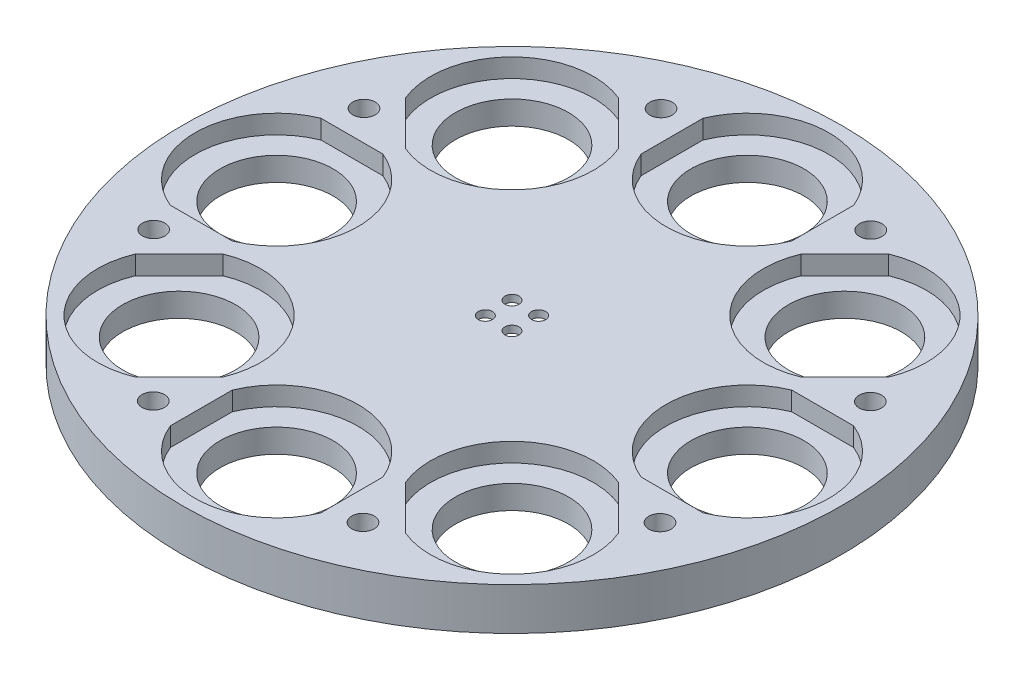
from build123d import *

# Parameters (mm, degrees)
SKETCH1_R           = 70
SKETCH1_R_2         = 12
BOSS_EXTRUDE1_DEPTH = 25
CUT_EXTRUDE1_DEPTH  = 10
SKETCH3_R           = 20
CUT_EXTRUDE2_DEPTH  = 7.5
CUT_EXTRUDE3_START  = -6
SKETCH4_R           = 70
CUT_EXTRUDE3_DEPTH  = 6
SKETCH5_R           = 1.5
CUT_EXTRUDE4_DEPTH  = 100.278648258
SKETCH7_R           = 2.38125
CUT_EXTRUDE5_DEPTH  = 100.403219264


with BuildPart() as part:
    # Sketch1 → Boss-Extrude1 (new body)
    with BuildSketch(Plane(origin=(0, 0, 0), x_dir=(1, 0, 0), z_dir=(0, 1, 0))):
        Circle(SKETCH1_R)
        with Locations((50, 0)):
            Circle(SKETCH1_R_2, mode=Mode.SUBTRACT)
        with Locations((35.355339059, -35.355339059)):
            Circle(SKETCH1_R_2, mode=Mode.SUBTRACT)
        with Locations((0, -50)):
            Circle(SKETCH1_R_2, mode=Mode.SUBTRACT)
        with Locations((-35.355339059, -35.355339059)):
            Circle(SKETCH1_R_2, mode=Mode.SUBTRACT)
        with Locations((-50, 0)):
            Circle(SKETCH1_R_2, mode=Mode.SUBTRACT)
        with Locations((-35.355339059, 35.355339059)):
            Circle(SKETCH1_R_2, mode=Mode.SUBTRACT)
        with Locations((0, 50)):
            Circle(SKETCH1_R_2, mode=Mode.SUBTRACT)
        with Locations((35.355339059, 35.355339059)):
            Circle(SKETCH1_R_2, mode=Mode.SUBTRACT)
    extrude(amount=BOSS_EXTRUDE1_DEPTH)

    # Sketch2 → Cut-Extrude1 (cut)
    with BuildSketch(Plane(origin=(0, 25, 0), x_dir=(1, 0, 0), z_dir=(0, 1, 0))):
        with BuildLine():
            Line((50, 16), (43.42048634, 16))
            ThreePointArc((43.42048634, 16), (32.7, 0), (43.42048634, -16))
            Line((43.42048634, -16), (50, -16))
            Line((50, -16), (56.57951366, -16))
            ThreePointArc((56.57951366, -16), (67.3, 0), (56.57951366, 16))
            Line((56.57951366, 16), (50, 16))
        make_face()
        with BuildLine():
            Line((46.669047558, -24.04163056), (42.016628833, -19.389211835))
            ThreePointArc((42.016628833, -19.389211835), (23.122391745, -23.122391745), (19.389211835, -42.016628833))
            Line((19.389211835, -42.016628833), (24.04163056, -46.669047558))
            Line((24.04163056, -46.669047558), (28.694049286, -51.321466284))
            ThreePointArc((28.694049286, -51.321466284), (47.588286374, -47.588286374), (51.321466284, -28.694049286))
            Line((51.321466284, -28.694049286), (46.669047558, -24.04163056))
        make_face()
        with BuildLine():
            Line((16, -50), (16, -43.42048634))
            ThreePointArc((16, -43.42048634), (0, -32.7), (-16, -43.42048634))
            Line((-16, -43.42048634), (-16, -50))
            Line((-16, -50), (-16, -56.57951366))
            ThreePointArc((-16, -56.57951366), (0, -67.3), (16, -56.57951366))
            Line((16, -56.57951366), (16, -50))
        make_face()
        with BuildLine():
            Line((-24.04163056, -46.669047558), (-19.389211835, -42.016628833))
            ThreePointArc((-19.389211835, -42.016628833), (-23.122391745, -23.122391745), (-42.016628833, -19.389211835))
            Line((-42.016628833, -19.389211835), (-46.669047558, -24.04163056))
            Line((-46.669047558, -24.04163056), (-51.321466284, -28.694049286))
            ThreePointArc((-51.321466284, -28.694049286), (-47.588286374, -47.588286374), (-28.694049286, -51.321466284))
            Line((-28.694049286, -51.321466284), (-24.04163056, -46.669047558))
        make_face()
        with BuildLine():
            Line((-50, -16), (-43.42048634, -16))
            ThreePointArc((-43.42048634, -16), (-32.7, 0), (-43.42048634, 16))
            Line((-43.42048634, 16), (-50, 16))
            Line((-50, 16), (-56.57951366, 16))
            ThreePointArc((-56.57951366, 16), (-67.3, 0), (-56.57951366, -16))
            Line((-56.57951366, -16), (-50, -16))
        make_face()
        with BuildLine():
            Line((-46.669047558, 24.04163056), (-42.016628833, 19.389211835))
            ThreePointArc((-42.016628833, 19.389211835), (-23.122391745, 23.122391745), (-19.389211835, 42.016628833))
            Line((-19.389211835, 42.016628833), (-24.04163056, 46.669047558))
            Line((-24.04163056, 46.669047558), (-28.694049286, 51.321466284))
            ThreePointArc((-28.694049286, 51.321466284), (-47.588286374, 47.588286374), (-51.321466284, 28.694049286))
            Line((-51.321466284, 28.694049286), (-46.669047558, 24.04163056))
        make_face()
        with BuildLine():
            Line((-16, 50), (-16, 43.42048634))
            ThreePointArc((-16, 43.42048634), (0, 32.7), (16, 43.42048634))
            Line((16, 43.42048634), (16, 50))
            Line((16, 50), (16, 56.57951366))
            ThreePointArc((16, 56.57951366), (0, 67.3), (-16, 56.57951366))
            Line((-16, 56.57951366), (-16, 50))
        make_face()
        with BuildLine():
            Line((24.04163056, 46.669047558), (19.389211835, 42.016628833))
            ThreePointArc((19.389211835, 42.016628833), (23.122391745, 23.122391745), (42.016628833, 19.389211835))
            Line((42.016628833, 19.389211835), (46.669047558, 24.04163056))
            Line((46.669047558, 24.04163056), (51.321466284, 28.694049286))
            ThreePointArc((51.321466284, 28.694049286), (47.588286374, 47.588286374), (28.694049286, 51.321466284))
            Line((28.694049286, 51.321466284), (24.04163056, 46.669047558))
        make_face()
    extrude(amount=-CUT_EXTRUDE1_DEPTH, mode=Mode.SUBTRACT)


with BuildPart() as body_2:
    # Split1: the piece on the far side of the plane
    add(part.part)
    split(bisect_by=Plane.ZX.offset(10), keep=Keep.BOTTOM)


with BuildPart() as part_1:
    add(part.part)

    # Split1
    split(bisect_by=Plane.ZX.offset(10), keep=Keep.TOP)

    # Sketch3 → Cut-Extrude2 (cut)
    with BuildSketch(Plane.XZ.offset(-10)):
        Circle(SKETCH3_R)
    extrude(amount=-CUT_EXTRUDE2_DEPTH, mode=Mode.SUBTRACT)

    # Sketch4 → Cut-Extrude3 (cut)
    with BuildSketch(Plane(origin=(0, 25, 0), x_dir=(1, 0, 0), z_dir=(0, 1, 0)).offset(CUT_EXTRUDE3_START)):
        Circle(SKETCH4_R)
    extrude(amount=CUT_EXTRUDE3_DEPTH, mode=Mode.SUBTRACT)

    # Sketch5 → Cut-Extrude4 (cut, through all)
    with BuildSketch(Plane.XZ.offset(-17.5)):
        with Locations((2.825415776, 2.831435271)):
            Circle(SKETCH5_R)
        with Locations((2.831435271, -2.825415776)):
            Circle(SKETCH5_R)
        with Locations((-2.825415776, -2.831435271)):
            Circle(SKETCH5_R)
        with Locations((-2.831435271, 2.825415776)):
            Circle(SKETCH5_R)
    extrude(amount=-CUT_EXTRUDE4_DEPTH, mode=Mode.SUBTRACT)

    # Sketch7 → Cut-Extrude5 (cut, through all)
    with BuildSketch(Plane(origin=(0, 19, 0), x_dir=(1, 0, 0), z_dir=(0, 1, 0))):
        with Locations((-22.229511812, 53.882002374)):
            Circle(SKETCH7_R)
        with Locations((22.381690718, 53.818967807)):
            Circle(SKETCH7_R)
        with Locations((53.882002374, 22.229511812)):
            Circle(SKETCH7_R)
        with Locations((53.818967807, -22.381690718)):
            Circle(SKETCH7_R)
        with Locations((22.229511812, -53.882002374)):
            Circle(SKETCH7_R)
        with Locations((-22.381690718, -53.818967807)):
            Circle(SKETCH7_R)
        with Locations((-53.882002374, -22.229511812)):
            Circle(SKETCH7_R)
        with Locations((-53.818967807, 22.381690718)):
            Circle(SKETCH7_R)
    extrude(amount=-CUT_EXTRUDE5_DEPTH, mode=Mode.SUBTRACT)


solid = part_1.part
